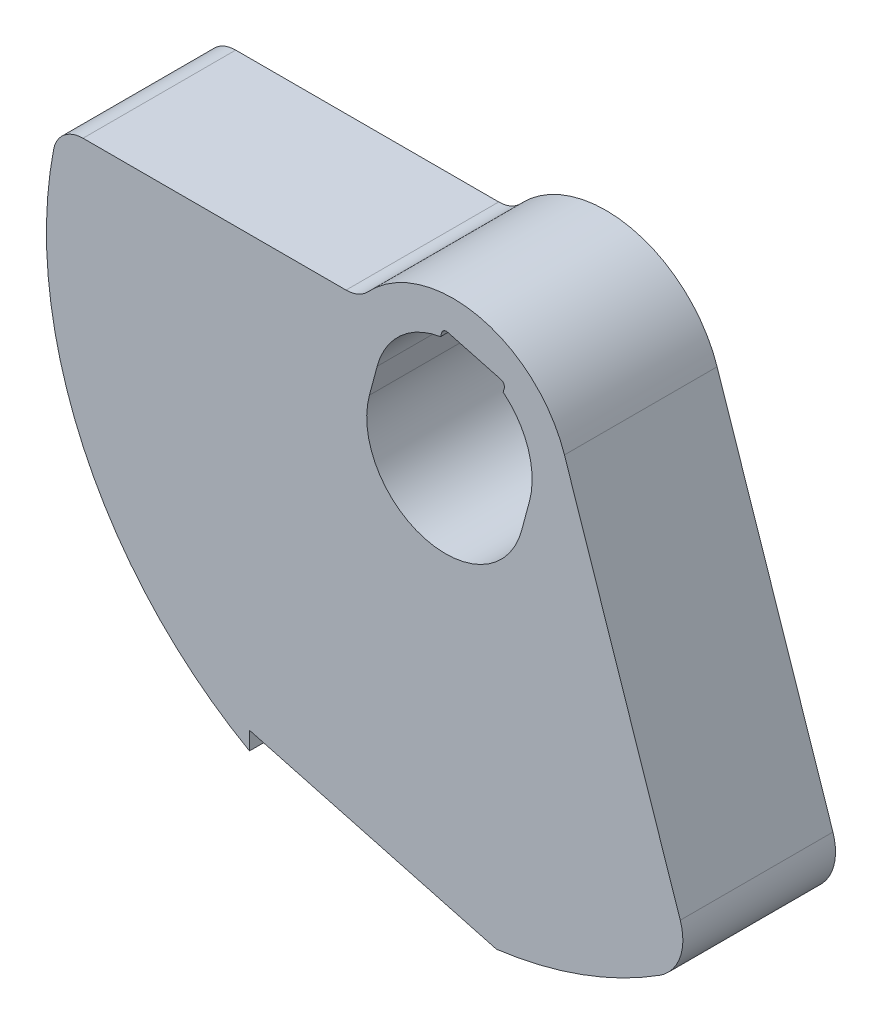
from build123d import *

# Parameters (mm, degrees)
SKETCH1_R               = 1.1938
BOSS_EXTRUDE1_DEPTH     = 7.7724
CUT_EXTRUDE1_DEPTH      = 30.656212081
CUT_EXTRUDE1_DEPTH_BACK = 30.656212081
FILLET1_R               = 2.54


with BuildPart() as part:
    # Sketch1 → Boss-Extrude1 (new body)
    with BuildSketch(Plane.XY):
        with BuildLine():
            ThreePointArc((-3.95481445, 5.560217822), (-4.460344292, 5.205196933), (-5.065262452, 5.08))
            Line((-5.065262452, 5.08), (-18.456556559, 5.08))
            ThreePointArc((-18.456556559, 5.08), (-19.426909517, 4.731155792), (-19.953034117, 3.844324324))
            ThreePointArc((-19.953034117, 3.844324324), (-18.44069754, -8.534815418), (-9.9822, -17.699098371))
            Line((-9.9822, -17.699098371), (-9.9822, -16.784328658))
            Line((-9.9822, -16.784328658), (2.593084415, -20.153865962))
            ThreePointArc((2.593084415, -20.153865962), (10.900004065, -17.149119843), (17.146958643, -10.903403565))
            Line((17.146958643, -10.903403565), (12.940315476, -3.61728387))
            ThreePointArc((12.940315476, -3.61728387), (12.796393961, -3.475289825), (12.60008731, -3.426922378))
            ThreePointArc((12.60008731, -3.426922378), (9.17217903, -2.398369889), (7.028137334, 0.467212181))
            Line((7.028137334, 0.467212181), (6.053096787, 3.371693793))
            ThreePointArc((6.053096787, 3.371693793), (1.669604011, 7.303273092), (-3.95481445, 5.560217822))
        make_face()
        with Locations((12.7, -9.398)):
            Circle(SKETCH1_R, mode=Mode.SUBTRACT)
        with BuildLine():
            ThreePointArc((3.876453526, -1.038692592), (-1.038692592, -3.876453526), (-3.876453526, 1.038692592))
            Line((-3.876453526, 1.038692592), (-3.482013301, 2.510763551))
            ThreePointArc((-3.482013301, 2.510763551), (-2.298514325, 4.447599489), (-0.253578298, 5.432607064))
            Line((-0.253578298, 5.432607064), (-0.201054745, 5.628627633))
            ThreePointArc((-0.201054745, 5.628627633), (-0.082709585, 5.782858048), (0.110030452, 5.808232755))
            Line((0.110030452, 5.808232755), (2.808827211, 5.085092343))
            ThreePointArc((2.808827211, 5.085092343), (2.963057626, 4.966747183), (2.988432333, 4.774007146))
            Line((2.988432333, 4.774007146), (2.93590878, 4.577986577))
            ThreePointArc((2.93590878, 4.577986577), (4.214371541, 2.702476981), (4.270893751, 0.433378367))
            Line((4.270893751, 0.433378367), (3.876453526, -1.038692592))
        make_face(mode=Mode.SUBTRACT)
    extrude(amount=-BOSS_EXTRUDE1_DEPTH)

    # Sketch2 → Cut-Extrude1 (cut, two sides: drawn at the far end of the back side and taken through both)
    with BuildSketch(Plane.XY.offset(-CUT_EXTRUDE1_DEPTH_BACK)):
        Polygon((-21.844195139, 86.473029104), (7.028137334, 0.467212181), (12.549933302, -15.98128825), (41.422265775, -101.987105173), (213.433899622, -44.242440226), (150.167438707, 144.217694051), align=None)
    extrude(amount=CUT_EXTRUDE1_DEPTH + CUT_EXTRUDE1_DEPTH_BACK, mode=Mode.SUBTRACT)

    # Fillet1
    fillet1_edges = [part.edges().sort_by_distance(p)[0] for p in [
        (12.549933302, -15.98128825, -3.8862),
    ]]
    fillet(fillet1_edges, radius=FILLET1_R)


solid = part.part
